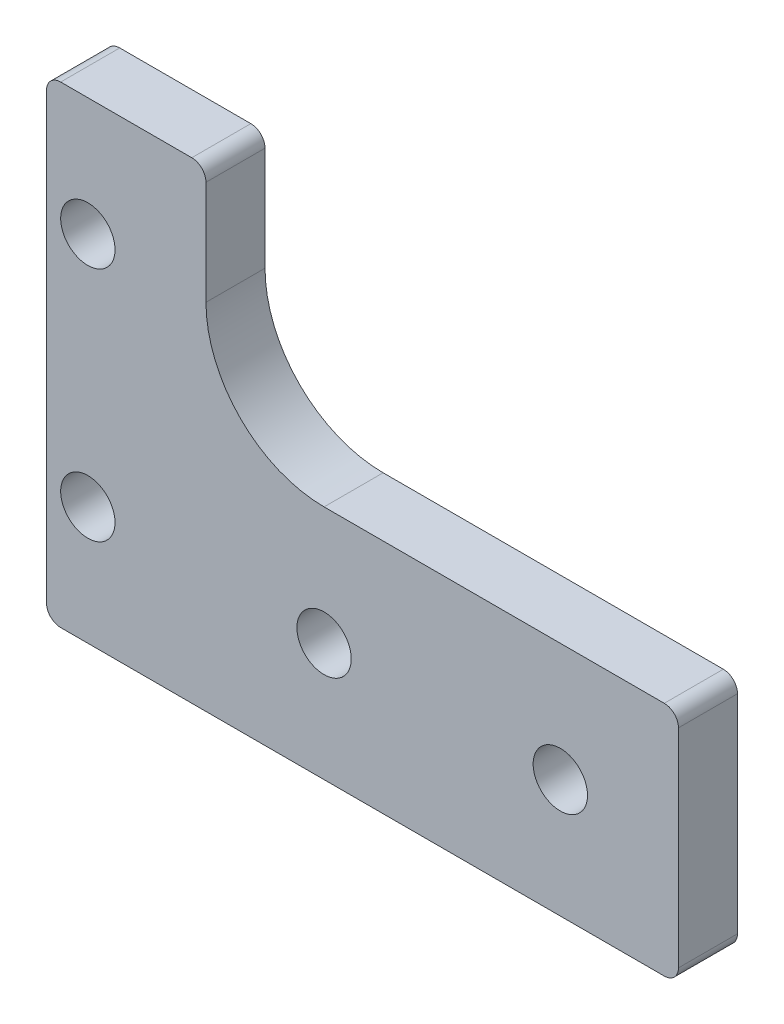
from build123d import *

# Parameters (mm, degrees)
BOSS_EXTRUDE1_DEPTH = 6.35
SKETCH2_R           = 2.921
CUT_EXTRUDE1_DEPTH  = 92.800885072
SKETCH3_W           = 8.255
SKETCH3_H           = 50.8
CUT_EXTRUDE2_DEPTH  = 92.800885072
FILLET1_R           = 12.7
FILLET2_R           = 1.524


with BuildPart() as part:
    # Sketch1 → Boss-Extrude1 (new body)
    with BuildSketch(Plane.XY):
        Polygon((0, 0), (0, 50.8), (25.4, 50.8), (25.4, 25.4), (76.2, 25.4), (76.2, 0), align=None)
    extrude(amount=BOSS_EXTRUDE1_DEPTH)

    # Sketch2 → Cut-Extrude1 (cut, through all)
    with BuildSketch(Plane.XY.offset(6.35)):
        with Locations((12.7, 38.1)):
            Circle(SKETCH2_R)
        with Locations((12.7, 12.7)):
            Circle(SKETCH2_R)
        with Locations((38.1, 12.7)):
            Circle(SKETCH2_R)
        with Locations((63.5, 12.7)):
            Circle(SKETCH2_R)
    extrude(amount=-CUT_EXTRUDE1_DEPTH, mode=Mode.SUBTRACT)

    # Sketch3 → Cut-Extrude2 (cut, through all)
    with BuildSketch(Plane.XY.offset(6.35)):
        with Locations((4.1275, 25.4)):
            Rectangle(SKETCH3_W, SKETCH3_H)
    extrude(amount=-CUT_EXTRUDE2_DEPTH, mode=Mode.SUBTRACT)

    # Fillet1
    fillet1_edges = [part.edges().sort_by_distance(p)[0] for p in [
        (25.4, 25.4, 3.175),
    ]]
    fillet(fillet1_edges, radius=FILLET1_R)

    # Fillet2
    fillet2_edges = [part.edges().sort_by_distance(p)[0] for p in [
        (76.2, 0, 3.175),
        (76.2, 25.4, 3.175),
        (8.255, 0, 3.175),
        (25.4, 50.8, 3.175),
        (8.255, 50.8, 3.175),
    ]]
    fillet(fillet2_edges, radius=FILLET2_R)


solid = part.part
